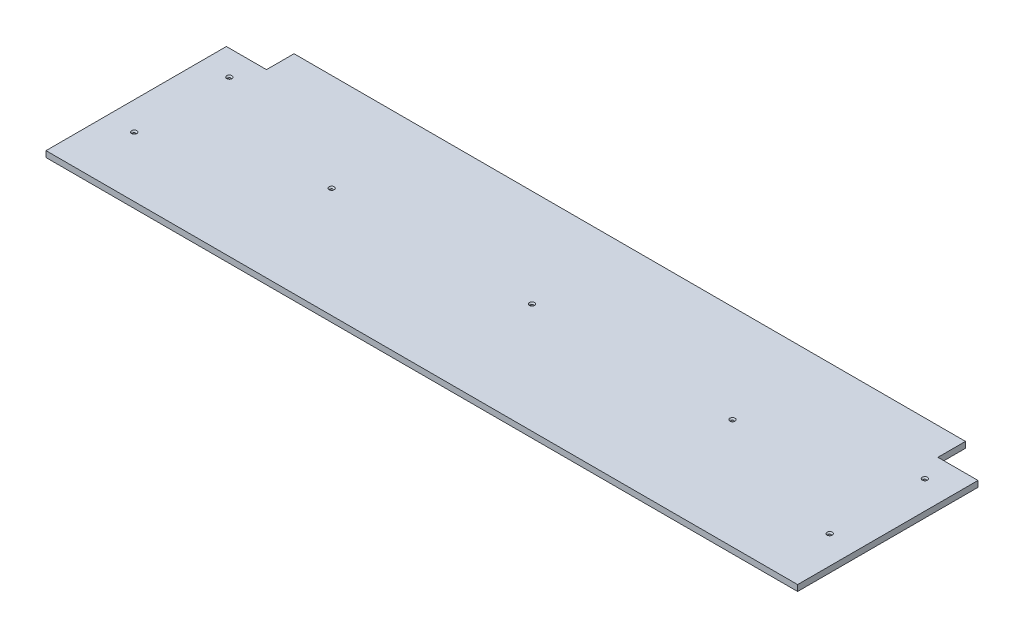
from build123d import *

# Parameters (mm, degrees)
SKETCH1_W                                       = 1500
SKETCH1_H                                       = 415
RAWMATERIAL_DEPTH                               = 12
CSK_FOR_M5_FLAT_HEAD_MACHINE_SCREW1_D           = 5.2
CSK_FOR_M5_FLAT_HEAD_MACHINE_SCREW1_CSINK_D     = 10.4
CSK_FOR_M5_FLAT_HEAD_MACHINE_SCREW1_CSINK_ANGLE = 90
SKETCH5_W                                       = 80
SKETCH5_H                                       = 55
FRAME_SLOTS_DEPTH                               = 779.267466878


with BuildPart() as part:
    # Sketch1 → RawMaterial (new body)
    with BuildSketch(Plane(origin=(0, 0, 0), x_dir=(1, 0, 0), z_dir=(0, 1, 0))):
        Rectangle(SKETCH1_W, SKETCH1_H)
    extrude(amount=RAWMATERIAL_DEPTH)

    # CSK for M5 Flat Head Machine Screw1 (through all)
    with Locations(Plane(origin=(0, 12, 0), x_dir=(-1, 0, 0), z_dir=(0, 1, 0))):
        with Locations((-694, -102.5), (-694, 87.5), (-400, -12.5), (400, -12.5), (694, 87.5), (694, -102.5), (0, -12.5)):
            CounterSinkHole(CSK_FOR_M5_FLAT_HEAD_MACHINE_SCREW1_D / 2, CSK_FOR_M5_FLAT_HEAD_MACHINE_SCREW1_CSINK_D / 2, counter_sink_angle=CSK_FOR_M5_FLAT_HEAD_MACHINE_SCREW1_CSINK_ANGLE)

    # Sketch5 → Frame Slots (cut, through all)
    with BuildSketch(Plane.XZ):
        with Locations((710, -180)):
            Rectangle(SKETCH5_W, SKETCH5_H)
        with Locations((-710, -180)):
            Rectangle(SKETCH5_W, SKETCH5_H)
    extrude(amount=-FRAME_SLOTS_DEPTH, mode=Mode.SUBTRACT)


solid = part.part
